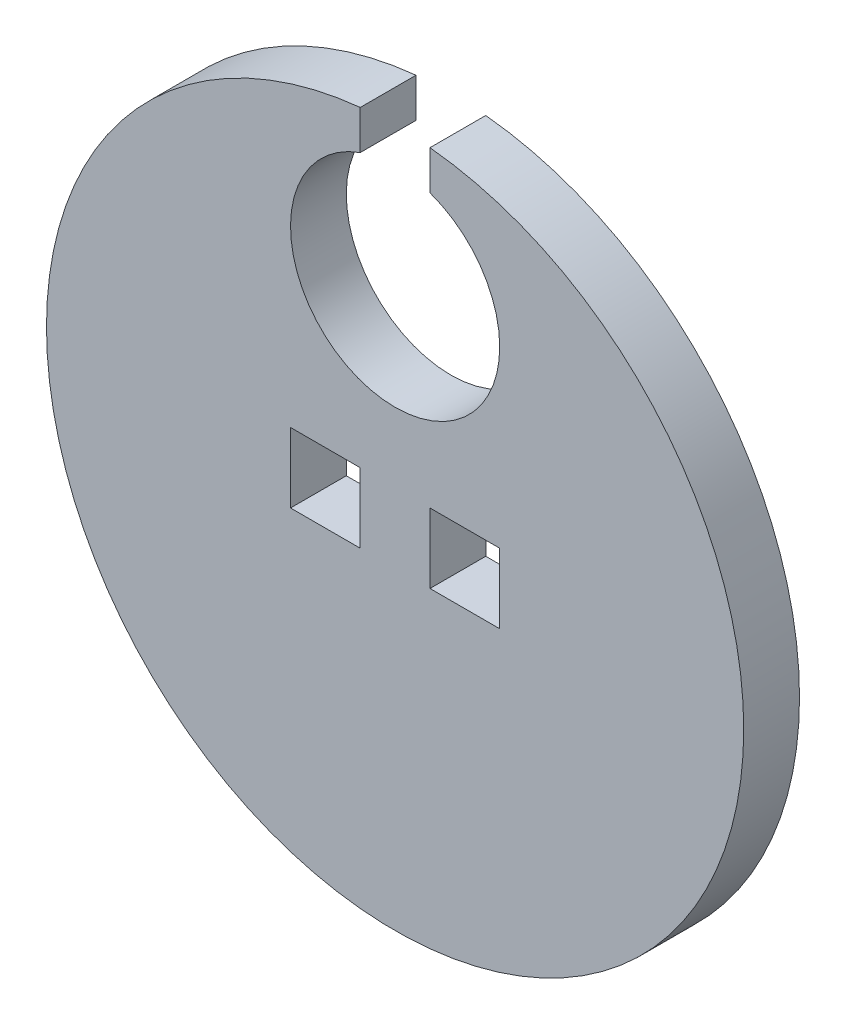
from build123d import *

# Parameters (mm, degrees)
SKETCH1_R           = 15.875
SKETCH1_W           = 3.175
SKETCH1_H           = 3.175
BOSS_EXTRUDE1_DEPTH = 2.54
CUT_EXTRUDE1_DEPTH  = 2.54


with BuildPart() as part:
    # Sketch1 → Boss-Extrude1 (new body)
    with BuildSketch(Plane.XY):
        Circle(SKETCH1_R)
        with Locations((-3.175, 0)):
            Rectangle(SKETCH1_W, SKETCH1_H, mode=Mode.SUBTRACT)
        with Locations((3.175, 0)):
            Rectangle(SKETCH1_W, SKETCH1_H, mode=Mode.SUBTRACT)
    extrude(amount=BOSS_EXTRUDE1_DEPTH)

    # Sketch2 → Cut-Extrude1 (cut)
    with BuildSketch(Plane.XY.offset(2.54)):
        with BuildLine():
            Line((-1.5875, 14.015128061), (-1.5875, 19.05))
            Line((-1.5875, 19.05), (1.5875, 19.05))
            Line((1.5875, 19.05), (1.5875, 14.015128061))
            ThreePointArc((1.5875, 14.015128061), (0, 4.7625), (-1.5875, 14.015128061))
        make_face()
    extrude(amount=-CUT_EXTRUDE1_DEPTH, mode=Mode.SUBTRACT)


solid = part.part
